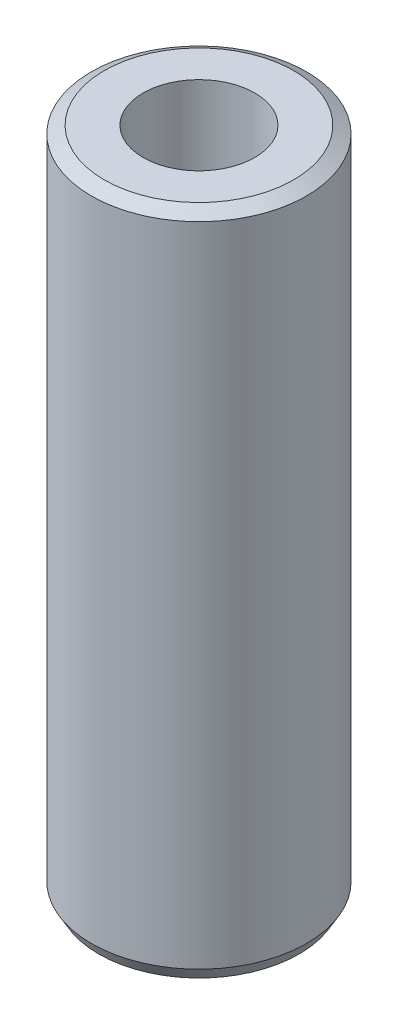
from build123d import *
from OCP.BRepFilletAPI import BRepFilletAPI_MakeChamfer

# Parameters (mm, degrees)
SKETCH1_R           = 35
BOSS_EXTRUDE1_DEPTH = 217.205687179
SKETCH2_R           = 18.181134303
CUT_EXTRUDE1_DEPTH  = 223.774124492
CHAMFER1_SIZE       = 2.425517784
CHAMFER1_SIZE2      = 4.201120037


with BuildPart() as part:
    # Sketch1 → Boss-Extrude1 (new body)
    with BuildSketch(Plane(origin=(0, 0, 0), x_dir=(1, 0, 0), z_dir=(0, 1, 0))):
        Circle(SKETCH1_R)
    extrude(amount=BOSS_EXTRUDE1_DEPTH)

    # Sketch2 → Cut-Extrude1 (cut, through all)
    with BuildSketch(Plane(origin=(0, 0, 0), x_dir=(1, 0, 0), z_dir=(0, 1, 0))):
        Circle(SKETCH2_R)
    extrude(amount=CUT_EXTRUDE1_DEPTH, mode=Mode.SUBTRACT)

    # Chamfer1: one chamfer whose edges measure the first distance from different faces: ONE call of the kernel's chamfer builder (chamfer() names one face for all edges)
    chamfer1_edges_1 = [part.edges().sort_by_distance(p)[0] for p in [
        (-35, 217.205687179, 0),
    ]]
    chamfer1_side_1 = [part.faces().sort_by_distance(p)[0] for p in [
        (-35, 108.60284359, 0),
    ]]
    chamfer1_edges_2 = [part.edges().sort_by_distance(p)[0] for p in [
        (-35, 0, 0),
    ]]
    chamfer1_side_2 = [part.faces().sort_by_distance(p)[0] for p in [
        (-34.010050506, 0, 0),
    ]]
    chamfer1 = BRepFilletAPI_MakeChamfer(part.part.solid().wrapped)
    for e in chamfer1_edges_1:
        chamfer1.Add(CHAMFER1_SIZE, CHAMFER1_SIZE2, e.wrapped, chamfer1_side_1[0].wrapped)  # the first distance lies on this face
    for e in chamfer1_edges_2:
        chamfer1.Add(CHAMFER1_SIZE, CHAMFER1_SIZE2, e.wrapped, chamfer1_side_2[0].wrapped)  # the first distance lies on this face
    add(Compound.cast(chamfer1.Shape()), mode=Mode.REPLACE)


solid = part.part
